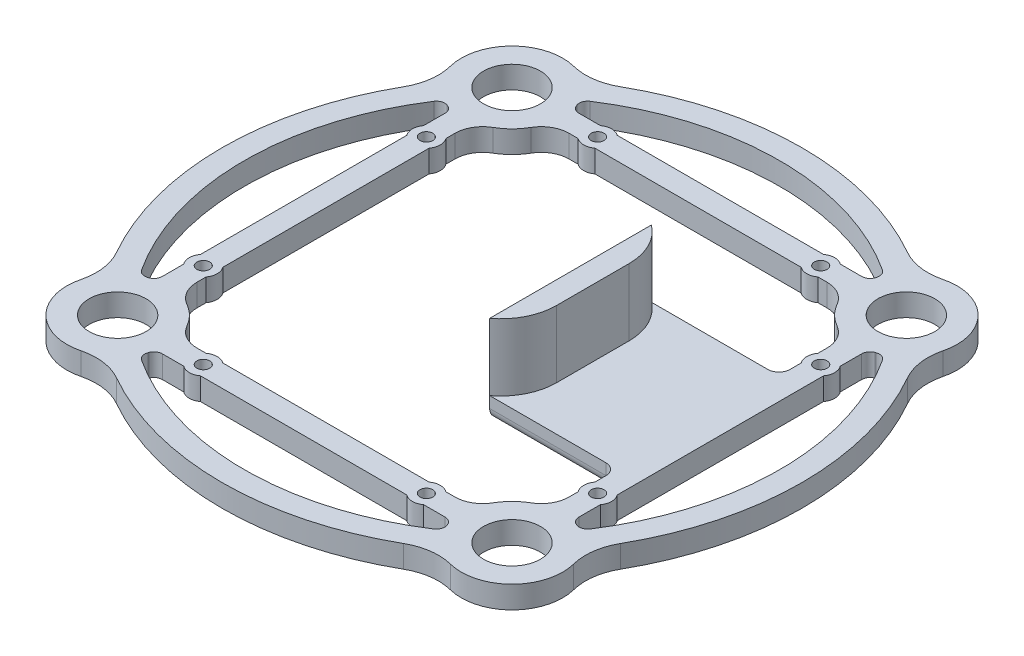
from build123d import *

# Parameters (mm, degrees)
SKETCH1_R           = 5.1
BOSS_EXTRUDE1_DEPTH = 4
BOSS_EXTRUDE2_START = -4
BOSS_EXTRUDE2_DEPTH = 4
SKETCH3_R           = 2.5
BOSS_EXTRUDE3_DEPTH = 4
SKETCH4_R           = 1.15
CUT_EXTRUDE1_DEPTH  = 4
FILLET1_R           = 10
FILLET2_R           = 1.5
FILLET3_R           = 5
SKETCH5_W           = 22.86
SKETCH5_H           = 29
BOSS_EXTRUDE4_DEPTH = 4
SKETCH6_W           = 4
SKETCH6_H           = 29
BOSS_EXTRUDE5_DEPTH = 16
FILLET4_R           = 10
FILLET5_R           = 2


with BuildPart() as part:
    # Sketch1 → Boss-Extrude1 (new body)
    with BuildSketch(Plane(origin=(0, 0, 0), x_dir=(1, 0, 0), z_dir=(0, 1, 0))):
        with BuildLine():
            ThreePointArc((-42.589636172, 29.834927363), (-52, 0), (-42.589636172, -29.834927363))
            ThreePointArc((-42.589636172, -29.834927363), (-41.790010768, -41.790010768), (-29.834927363, -42.589636172))
            ThreePointArc((-29.834927363, -42.589636172), (0, -52), (29.834927363, -42.589636172))
            ThreePointArc((29.834927363, -42.589636172), (41.790010768, -41.790010768), (42.589636172, -29.834927363))
            ThreePointArc((42.589636172, -29.834927363), (52, 0), (42.589636172, 29.834927363))
            ThreePointArc((42.589636172, 29.834927363), (41.790010768, 41.790010768), (29.834927363, 42.589636172))
            ThreePointArc((29.834927363, 42.589636172), (0, 52), (-29.834927363, 42.589636172))
            ThreePointArc((-29.834927363, 42.589636172), (-41.790010768, 41.790010768), (-42.589636172, 29.834927363))
        make_face()
        with Locations(Location((-35.355339059, -35.355339059, 0), (0, 0, 270))):
            Circle(SKETCH1_R, mode=Mode.SUBTRACT)
        with Locations(Location((35.355339059, -35.355339059, 0), (0, 0, 270))):
            Circle(SKETCH1_R, mode=Mode.SUBTRACT)
        with BuildLine():
            ThreePointArc((-27.258640426, -39.509068859), (-28.920667351, -28.920667351), (-39.509068859, -27.258640426))
            ThreePointArc((-39.509068859, -27.258640426), (-48, 0), (-39.509068859, 27.258640426))
            ThreePointArc((-39.509068859, 27.258640426), (-28.920667351, 28.920667351), (-27.258640426, 39.509068859))
            ThreePointArc((-27.258640426, 39.509068859), (0, 48), (27.258640426, 39.509068859))
            ThreePointArc((27.258640426, 39.509068859), (28.920667351, 28.920667351), (39.509068859, 27.258640426))
            ThreePointArc((39.509068859, 27.258640426), (48, 0), (39.509068859, -27.258640426))
            ThreePointArc((39.509068859, -27.258640426), (28.920667351, -28.920667351), (27.258640426, -39.509068859))
            ThreePointArc((27.258640426, -39.509068859), (0, -48), (-27.258640426, -39.509068859))
        make_face(mode=Mode.SUBTRACT)
        with Locations(Location((-35.355339059, 35.355339059, 0), (0, 0, 270))):
            Circle(SKETCH1_R, mode=Mode.SUBTRACT)
        with Locations(Location((35.355339059, 35.355339059, 0), (0, 0, 270))):
            Circle(SKETCH1_R, mode=Mode.SUBTRACT)
    extrude(amount=BOSS_EXTRUDE1_DEPTH)

    # Sketch2 → Boss-Extrude2 (add)
    with BuildSketch(Plane(origin=(0, 4, 0), x_dir=(1, 0, 0), z_dir=(0, 1, 0)).offset(BOSS_EXTRUDE2_START)):
        with BuildLine():
            ThreePointArc((-26.255339059, 35.355339059), (-26.311135203, 34.349169788), (-26.477839411, 33.355339059))
            Line((-26.477839411, 33.355339059), (26.477839411, 33.355339059))
            ThreePointArc((26.477839411, 33.355339059), (26.255339059, 35.355339059), (26.477839411, 37.355339059))
            Line((26.477839411, 37.355339059), (-26.477839411, 37.355339059))
            ThreePointArc((-26.477839411, 37.355339059), (-26.311135203, 36.36150833), (-26.255339059, 35.355339059))
        make_face()
        with BuildLine():
            Line((-33.355339059, -26.477839411), (-33.355339059, 26.477839411))
            ThreePointArc((-33.355339059, 26.477839411), (-35.355339059, 26.255339059), (-37.355339059, 26.477839411))
            Line((-37.355339059, 26.477839411), (-37.355339059, -26.477839411))
            ThreePointArc((-37.355339059, -26.477839411), (-35.355339059, -26.255339059), (-33.355339059, -26.477839411))
        make_face()
        with BuildLine():
            ThreePointArc((37.355339059, 26.477839411), (35.355339059, 26.255339059), (33.355339059, 26.477839411))
            Line((33.355339059, 26.477839411), (33.355339059, -26.477839411))
            ThreePointArc((33.355339059, -26.477839411), (35.355339059, -26.255339059), (37.355339059, -26.477839411))
            Line((37.355339059, -26.477839411), (37.355339059, 26.477839411))
        make_face()
        with BuildLine():
            Line((26.477839411, -33.355339059), (-26.477839411, -33.355339059))
            ThreePointArc((-26.477839411, -33.355339059), (-26.311135203, -34.349169788), (-26.255339059, -35.355339059))
            ThreePointArc((-26.255339059, -35.355339059), (-26.311135203, -36.36150833), (-26.477839411, -37.355339059))
            Line((-26.477839411, -37.355339059), (26.477839411, -37.355339059))
            ThreePointArc((26.477839411, -37.355339059), (26.255339059, -35.355339059), (26.477839411, -33.355339059))
        make_face()
    extrude(amount=BOSS_EXTRUDE2_DEPTH)

    # Sketch3 → Boss-Extrude3 (add)
    with BuildSketch(Plane(origin=(0, 4, 0), x_dir=(1, 0, 0), z_dir=(0, 1, 0))):
        with Locations((-20, 35.355339059)):
            Circle(SKETCH3_R)
        with Locations((20, 35.355339059)):
            Circle(SKETCH3_R)
        with Locations((35.355339059, 20)):
            Circle(SKETCH3_R)
        with Locations((35.355339059, -20)):
            Circle(SKETCH3_R)
        with Locations((-35.355339059, -20)):
            Circle(SKETCH3_R)
        with Locations((-35.355339059, 20)):
            Circle(SKETCH3_R)
        with Locations((-20, -35.355339059)):
            Circle(SKETCH3_R)
        with Locations((20, -35.355339059)):
            Circle(SKETCH3_R)
    extrude(amount=-BOSS_EXTRUDE3_DEPTH)

    # Sketch4 → Cut-Extrude1 (cut)
    with BuildSketch(Plane(origin=(0, 4, 0), x_dir=(1, 0, 0), z_dir=(0, 1, 0))):
        with Locations(Location((-20, 35.355339059, 0), (0, 0, 270))):
            Circle(SKETCH4_R)
        with Locations(Location((20, 35.355339059, 0), (0, 0, 270))):
            Circle(SKETCH4_R)
        with Locations(Location((-35.355339059, 20, 0), (0, 0, 270))):
            Circle(SKETCH4_R)
        with Locations(Location((-35.355339059, -20, 0), (0, 0, 270))):
            Circle(SKETCH4_R)
        with Locations(Location((-20, -35.355339059, 0), (0, 0, 270))):
            Circle(SKETCH4_R)
        with Locations(Location((20, -35.355339059, 0), (0, 0, 270))):
            Circle(SKETCH4_R)
        with Locations(Location((35.355339059, -20, 0), (0, 0, 270))):
            Circle(SKETCH4_R)
        with Locations(Location((35.355339059, 20, 0), (0, 0, 270))):
            Circle(SKETCH4_R)
    extrude(amount=-CUT_EXTRUDE1_DEPTH, mode=Mode.SUBTRACT)

    # Fillet1
    fillet1_edges = [part.edges().sort_by_distance(p)[0] for p in [
        (-42.589636172, 2, 29.834927363),
        (-42.589636172, 2, -29.834927363),
        (-29.834927363, 2, -42.589636172),
        (29.834927363, 2, -42.589636172),
        (42.589636172, 2, -29.834927363),
        (42.589636172, 2, 29.834927363),
        (29.834927363, 2, 42.589636172),
        (-29.834927363, 2, 42.589636172),
    ]]
    fillet(fillet1_edges, radius=FILLET1_R)

    # Fillet2
    fillet2_edges = [part.edges().sort_by_distance(p)[0] for p in [
        (37.355339059, 2, -26.477839411),
        (37.355339059, 2, 26.477839411),
        (-26.477839411, 2, 37.355339059),
        (26.477839411, 2, 37.355339059),
        (27.258640426, 2, 39.509068859),
        (39.509068859, 2, 27.258640426),
        (39.509068859, 2, -27.258640426),
        (27.258640426, 2, -39.509068859),
        (-27.258640426, 2, -39.509068859),
        (-39.509068859, 2, -27.258640426),
        (-39.509068859, 2, 27.258640426),
        (-27.258640426, 2, 39.509068859),
        (-26.477839411, 2, -37.355339059),
        (26.477839411, 2, -37.355339059),
        (-37.355339059, 2, -26.477839411),
        (-37.355339059, 2, 26.477839411),
    ]]
    fillet(fillet2_edges, radius=FILLET2_R)

    # Fillet3
    fillet3_edges = [part.edges().sort_by_distance(p)[0] for p in [
        (33.355339059, 2, -26.477839411),
        (33.355339059, 2, 26.477839411),
        (-26.477839411, 2, 33.355339059),
        (26.477839411, 2, 33.355339059),
        (-26.477839411, 2, -33.355339059),
        (26.477839411, 2, -33.355339059),
        (-33.355339059, 2, -26.477839411),
        (-33.355339059, 2, 26.477839411),
    ]]
    fillet(fillet3_edges, radius=FILLET3_R)

    # Sketch5 → Boss-Extrude4 (add)
    with BuildSketch(Plane(origin=(0, 4, 0), x_dir=(1, 0, 0), z_dir=(0, 1, 0))):
        with Locations((21.925339059, 0)):
            Rectangle(SKETCH5_W, SKETCH5_H)
    extrude(amount=-BOSS_EXTRUDE4_DEPTH)

    # Sketch6 → Boss-Extrude5 (add)
    with BuildSketch(Plane.XZ):
        with Locations((12.495339059, 0)):
            Rectangle(SKETCH6_W, SKETCH6_H)
    extrude(amount=-BOSS_EXTRUDE5_DEPTH)

    # Fillet4
    # the kernel refuses this fillet: 10 mm, written as the material it takes off along each edge
    with BuildSketch(Plane(origin=(14.495339059, 4, -14.5), x_dir=(0, 0, 1), z_dir=(0, 1, 0))) as fillet4_piece_1:
        with BuildLine():
            CenterArc((8, -10), FILLET4_R, 90, 53.130102354)
            Line((0, -4), (0, 0))
            Line((0, 0), (8, 0))
        make_face()
    extrude(amount=32, mode=Mode.SUBTRACT)
    with BuildSketch(Plane(origin=(14.495339059, 4, 14.5), x_dir=(0, 0, -1), z_dir=(0, 1, 0))) as fillet4_piece_2:
        with BuildLine():
            CenterArc((8, 10), FILLET4_R, 216.869897646, 53.130102354)
            Line((0, 4), (0, 0))
            Line((0, 0), (8, 0))
        make_face()
    extrude(amount=32, mode=Mode.SUBTRACT)

    # Fillet5
    fillet5_edges = [part.edges().sort_by_distance(p)[0] for p in [
        (33.355339059, 0, 16.5),
        (33.355339059, 2, -14.5),
        (21.925339059, 0, 14.5),
        (33.355339059, 2, 14.5),
        (21.925339059, 0, -14.5),
        (33.355339059, 0, -16.5),
    ]]
    fillet(fillet5_edges, radius=FILLET5_R)


solid = part.part
